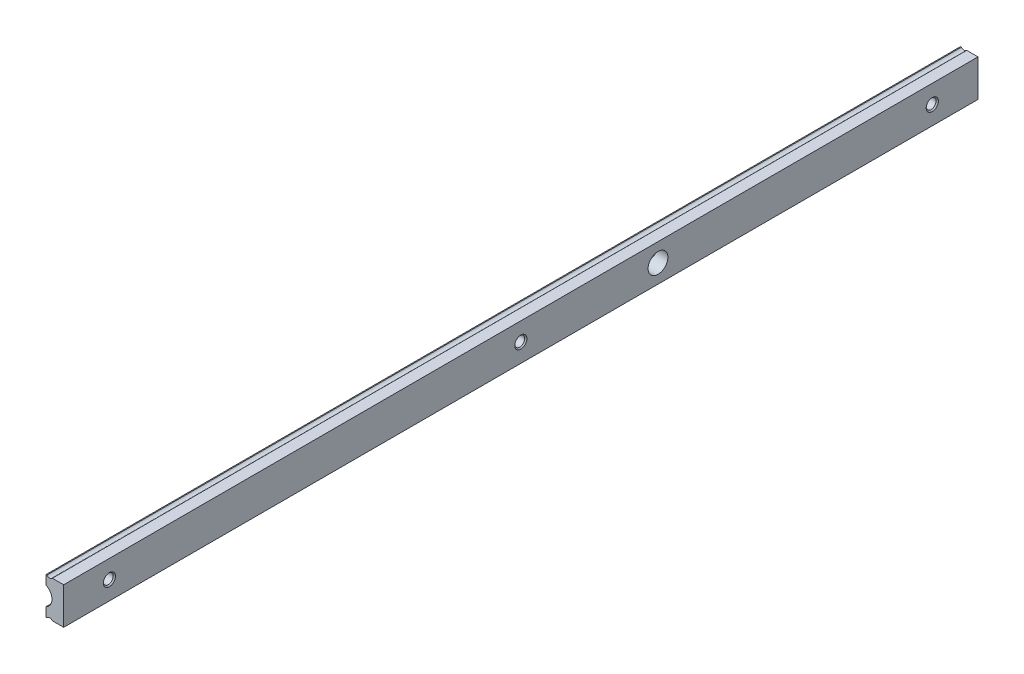
from build123d import *

# Parameters (mm, degrees)
BOSS_EXTRUDE1_DEPTH = 300
SKETCH5_R           = 3.2500000000000027
CUT_EXTRUDE1_DEPTH  = 6


with BuildPart() as part:
    # Sketch1 → Boss-Extrude1 (new body)
    with BuildSketch(Plane.XY):
        with BuildLine():
            Line((0, 2.9746951370636), (0, 0))
            Line((0, 0), (0.30557280900008, 0))
            ThreePointArc((0.30557280900008, 0), (1.1999999999999902, 0.4), (2.0944271909999004, 0))
            Line((2.0944271909999004, 0), (5.8, 0))
            Line((5.8, 0), (5.8, 12.1))
            Line((5.8, 12.1), (2.0944271909999004, 12.1))
            ThreePointArc((2.0944271909999004, 12.1), (1.1999999999999953, 11.700000000000001), (0.30557280900009, 12.1))
            Line((0.30557280900009, 12.1), (0, 12.1))
            Line((0, 12.1), (0, 9.1253048629364))
            ThreePointArc((0, 9.1253048629364), (1.9499999999999993, 6.05), (0, 2.9746951370636))
        make_face()
    extrude(amount=BOSS_EXTRUDE1_DEPTH)

    # Sketch2 → Cut-Revolve1 (revolve, cut)
    with BuildSketch(Plane.XY.offset(15)):
        Polygon((1.2995454169735001, 6.05), (1.2995454169735001, 8.05), (1.6785454169735001, 7.671), (5.420999999999999, 7.671), (5.8, 8.05), (5.8, 6.05), align=None)
    revolve(axis=Axis((5.8, 6.05, 15), (-1, 0, 0)), mode=Mode.SUBTRACT)

    # Sketch3 → Cut-Revolve2 (revolve, cut)
    with BuildSketch(Plane.XY.offset(285)):
        Polygon((1.2995454169735001, 6.05), (1.2995454169735001, 8.05), (1.6785454169735001, 7.671), (5.420999999999999, 7.671), (5.8, 8.05), (5.8, 6.05), align=None)
    revolve(axis=Axis((5.8, 6.05, 285), (-1, 0, 0)), mode=Mode.SUBTRACT)

    # Sketch4 → Cut-Revolve3 (revolve, cut)
    with BuildSketch(Plane.XY.offset(150)):
        Polygon((1.2995454169735001, 6.05), (1.2995454169735001, 8.05), (1.6785454169735001, 7.671), (5.420999999999999, 7.671), (5.8, 8.05), (5.8, 6.05), align=None)
    revolve(axis=Axis((5.8, 6.05, 150), (-1, 0, 0)), mode=Mode.SUBTRACT)

    # Sketch5 → Cut-Extrude1 (cut)
    with BuildSketch(Plane(origin=(5.8, 0, 0), x_dir=(0, 0, -1), z_dir=(1, 0, 0))):
        with Locations((-105, 6.05)):
            Circle(SKETCH5_R)
    extrude(amount=-CUT_EXTRUDE1_DEPTH, mode=Mode.SUBTRACT)


solid = part.part
